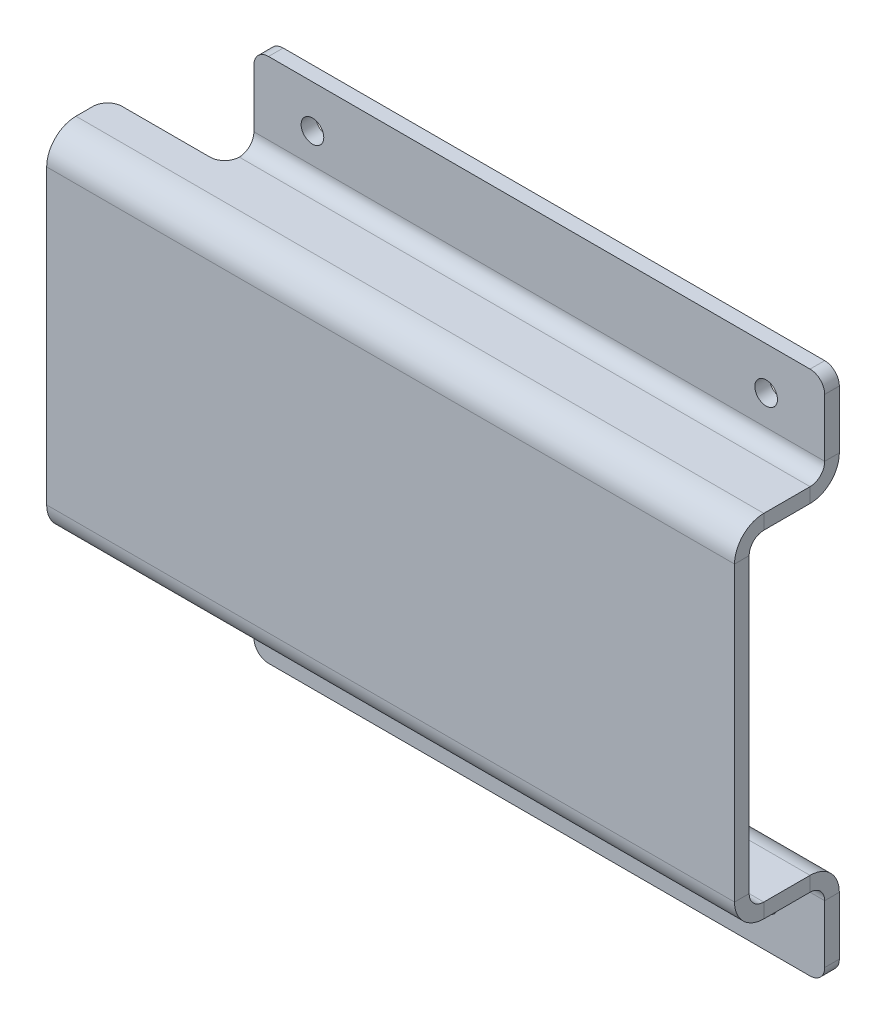
from build123d import *

# Parameters (mm, degrees)
SKETCH1_W                        = 149.225
SKETCH1_H                        = 76.2
BASE_FLANGE1_DEPTH               = 3.175
EDGE_FLANGE1_STRIP_W             = 19.05
EDGE_FLANGE1_STRIP_H             = 3.175
EDGE_FLANGE1_STRIP_CUT_DEPTH     = 149.225
EDGE_FLANGE1_STRIP_2_W           = 19.05
EDGE_FLANGE1_STRIP_2_H           = 3.175
EDGE_FLANGE1_STRIP_CUT_2_DEPTH   = 149.225
EDGE_FLANGE1_DEPTH               = 149.225
EDGE_FLANGE1_BEND_DEPTH          = 149.225
SKETCH17_W                       = 25.4
SKETCH17_H                       = 9.525
CUT_EXTRUDE1_DEPTH               = 110.04244332
EDGE_FLANGE2_STRIP_W             = 19.05
EDGE_FLANGE2_STRIP_H             = 3.175
EDGE_FLANGE2_STRIP_CUT_DEPTH     = 123.825
EDGE_FLANGE2_STRIP_2_W           = 19.05
EDGE_FLANGE2_STRIP_2_H           = 3.175
EDGE_FLANGE2_STRIP_CUT_2_DEPTH   = 123.825
EDGE_FLANGE2_DEPTH               = 123.825
EDGE_FLANGE2_BEND_DEPTH          = 123.825
SKETCH18_R                       = 2.3876
CUT_EXTRUDE2_DEPTH               = 97.614069214
LPATTERN1_COUNT                  = 2
LPATTERN1_PITCH                  = 98.425
LPATTERN1_COUNT_DIR2             = 2
LPATTERN1_PITCH_DIR2             = 95.25
FILLET1_R                        = 3.175
F_10_0_1935_DIAMETER_HOLE1_D     = 4.9149
F_10_0_1935_DIAMETER_HOLE1_DEPTH = 3.175


# Sheet-metal steps are written as plain solids
with BuildPart() as part:
    # Sketch1 → Base-Flange1 (new body)
    with BuildSketch(Plane.XY):
        Rectangle(SKETCH1_W, SKETCH1_H)
    extrude(amount=-BASE_FLANGE1_DEPTH)

    # Edge-Flange1 strip (across the edge) → Edge-Flange1 strip cut (cut)
    with BuildSketch(Plane(origin=(74.6125, -38.1, -3.175), x_dir=(0, 1, 0), z_dir=(-1, 0, 0))):
        with Locations((-3.175, -1.5875)):
            Rectangle(EDGE_FLANGE1_STRIP_W, EDGE_FLANGE1_STRIP_H)
    extrude(amount=EDGE_FLANGE1_STRIP_CUT_DEPTH, mode=Mode.SUBTRACT)

    # Edge-Flange1 strip 2 (across the edge) → Edge-Flange1 strip cut 2 (cut)
    with BuildSketch(Plane(origin=(-74.6125, 38.1, -3.175), x_dir=(0, -1, 0), z_dir=(1, 0, 0))):
        with Locations((-3.175, -1.5875)):
            Rectangle(EDGE_FLANGE1_STRIP_2_W, EDGE_FLANGE1_STRIP_2_H)
    extrude(amount=EDGE_FLANGE1_STRIP_CUT_2_DEPTH, mode=Mode.SUBTRACT)

    # Edge-Flange1 section (across the edge) → Edge-Flange1 (add)
    with BuildSketch(Plane(origin=(74.6125, -38.1, -3.175), x_dir=(0, 1, 0), z_dir=(-1, 0, 0))):
        with BuildLine():
            Line((0, 3.175), (0, 19.558))
            Line((0, 19.558), (3.175, 19.558))
            Line((3.175, 19.558), (3.175, 3.175))
            ThreePointArc((3.175, 3.175), (4.10493597, 0.92993597), (6.35, 0))
            Line((6.35, 0), (6.35, -3.175))
            ThreePointArc((6.35, -3.175), (1.859871939, -1.315128061), (0, 3.175))
        make_face()
    extrude(amount=EDGE_FLANGE1_DEPTH)

    # Edge-Flange1 section 2 (across the edge) → Edge-Flange1 bend (add)
    with BuildSketch(Plane(origin=(-74.6125, 38.1, -3.175), x_dir=(0, -1, 0), z_dir=(1, 0, 0))):
        with BuildLine():
            Line((0, 3.175), (0, 19.558))
            Line((0, 19.558), (3.175, 19.558))
            Line((3.175, 19.558), (3.175, 3.175))
            ThreePointArc((3.175, 3.175), (4.10493597, 0.92993597), (6.35, 0))
            Line((6.35, 0), (6.35, -3.175))
            ThreePointArc((6.35, -3.175), (1.859871939, -1.315128061), (0, 3.175))
        make_face()
    extrude(amount=EDGE_FLANGE1_BEND_DEPTH)

    # Sketch17 → Cut-Extrude1 (cut, through all)
    with BuildSketch(Plane.XZ.offset(38.1)):
        with Locations((-61.9125, -17.9705)):
            Rectangle(SKETCH17_W, SKETCH17_H)
    extrude(amount=-CUT_EXTRUDE1_DEPTH, mode=Mode.SUBTRACT)

    # Edge-Flange2 strip (across the edge) → Edge-Flange2 strip cut (cut)
    with BuildSketch(Plane(origin=(-49.2125, -38.1, -22.733), x_dir=(0, 0, 1), z_dir=(1, 0, 0))):
        with Locations((-3.175, -1.5875)):
            Rectangle(EDGE_FLANGE2_STRIP_W, EDGE_FLANGE2_STRIP_H)
    extrude(amount=EDGE_FLANGE2_STRIP_CUT_DEPTH, mode=Mode.SUBTRACT)

    # Edge-Flange2 strip 2 (across the edge) → Edge-Flange2 strip cut 2 (cut)
    with BuildSketch(Plane(origin=(74.6125, 38.1, -22.733), x_dir=(0, 0, 1), z_dir=(-1, 0, 0))):
        with Locations((-3.175, -1.5875)):
            Rectangle(EDGE_FLANGE2_STRIP_2_W, EDGE_FLANGE2_STRIP_2_H)
    extrude(amount=EDGE_FLANGE2_STRIP_CUT_2_DEPTH, mode=Mode.SUBTRACT)

    # Edge-Flange2 section (across the edge) → Edge-Flange2 (add)
    with BuildSketch(Plane(origin=(-49.2125, -38.1, -22.733), x_dir=(0, 0, 1), z_dir=(1, 0, 0))):
        with BuildLine():
            Line((0, 3.175), (0, 18.91284))
            Line((0, 18.91284), (3.175, 18.91284))
            Line((3.175, 18.91284), (3.175, 3.175))
            ThreePointArc((3.175, 3.175), (4.10493597, 0.92993597), (6.35, 0))
            Line((6.35, 0), (6.35, -3.175))
            ThreePointArc((6.35, -3.175), (1.859871939, -1.315128061), (0, 3.175))
        make_face()
    extrude(amount=EDGE_FLANGE2_DEPTH)

    # Edge-Flange2 section 2 (across the edge) → Edge-Flange2 bend (add)
    with BuildSketch(Plane(origin=(74.6125, 38.1, -22.733), x_dir=(0, 0, 1), z_dir=(-1, 0, 0))):
        with BuildLine():
            Line((0, 3.175), (0, 18.91284))
            Line((0, 18.91284), (3.175, 18.91284))
            Line((3.175, 18.91284), (3.175, 3.175))
            ThreePointArc((3.175, 3.175), (4.10493597, 0.92993597), (6.35, 0))
            Line((6.35, 0), (6.35, -3.175))
            ThreePointArc((6.35, -3.175), (1.859871939, -1.315128061), (0, 3.175))
        make_face()
    extrude(amount=EDGE_FLANGE2_BEND_DEPTH)

    # Sketch18 → Cut-Extrude2 (cut, through all)
    with BuildSketch(Plane(origin=(0, 0, -22.733), x_dir=(-1, 0, 0), z_dir=(0, 0, -1))):
        with Locations((-61.9125, -47.48784)):
            Circle(SKETCH18_R)
    cut_extrude2 = extrude(amount=-CUT_EXTRUDE2_DEPTH, mode=Mode.SUBTRACT)

    # LPattern1: Cut-Extrude2 2 × 2
    with Locations(*[(-i * LPATTERN1_PITCH, j * LPATTERN1_PITCH_DIR2, 0) for i in range(LPATTERN1_COUNT) for j in range(LPATTERN1_COUNT_DIR2) if (i, j) != (0, 0)]):
        add(cut_extrude2, mode=Mode.SUBTRACT)

    # Fillet1
    fillet1_edges = [part.edges().sort_by_distance(p)[0] for p in [
        (-49.2125, -36.5125, -13.208),
        (-49.2125, 36.5125, -13.208),
        (-74.6125, -36.5125, -13.208),
        (-74.6125, 36.5125, -13.208),
        (-49.2125, 57.01284, -21.1455),
        (74.6125, 57.01284, -21.1455),
        (74.6125, -57.01284, -21.1455),
        (-49.2125, -57.01284, -21.1455),
    ]]
    fillet(fillet1_edges, radius=FILLET1_R)

    # #10 (0.1935) Diameter Hole1
    with Locations(Plane.XY.offset(-19.558)):
        with Locations((-36.5125, 47.76216), (61.9125, 47.76216), (61.9125, -47.48784), (-36.5125, -47.48784)):
            Hole(F_10_0_1935_DIAMETER_HOLE1_D / 2, depth=F_10_0_1935_DIAMETER_HOLE1_DEPTH)


solid = part.part
